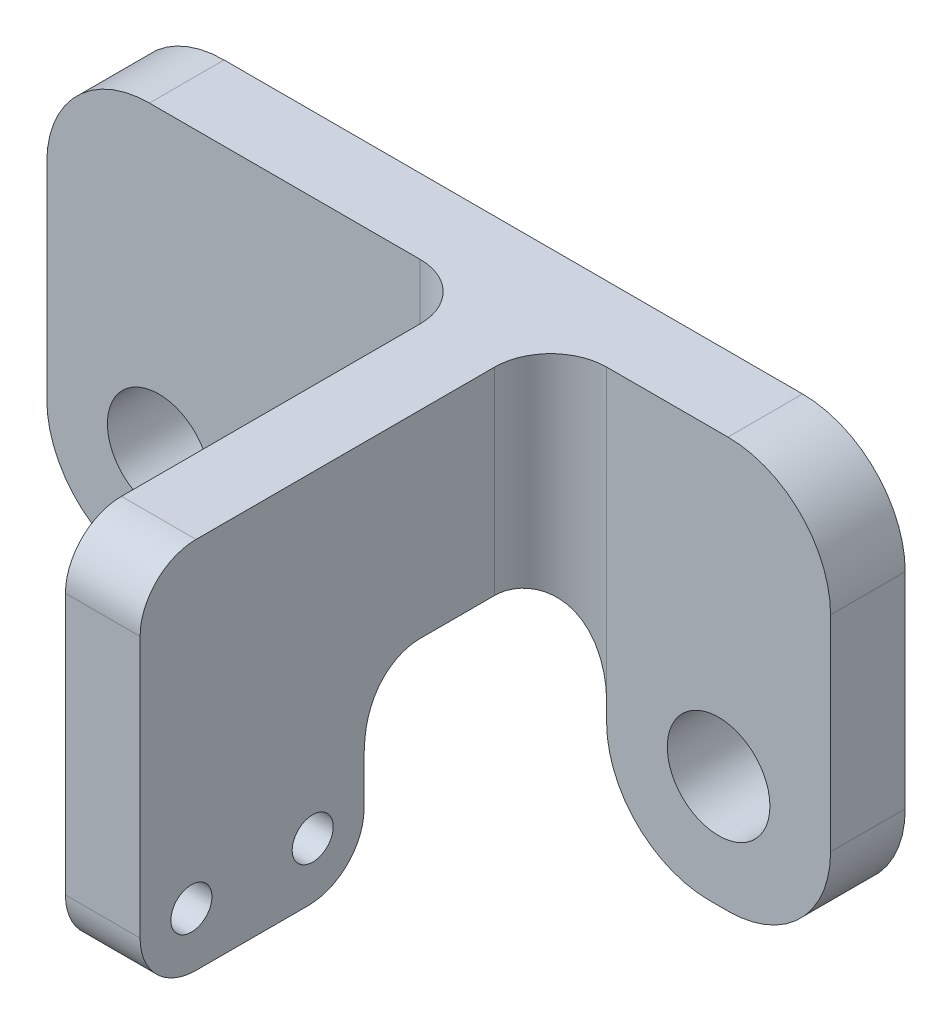
from build123d import *

# Parameters (mm, degrees)
SKETCH1_W           = 12
SKETCH1_H           = 12
SKETCH1_R           = 2.75
BOSS_EXTRUDE1_DEPTH = 4
SKETCH2_W           = 4
SKETCH2_H           = 10
BOSS_EXTRUDE2_DEPTH = 22
SKETCH3_W           = 4
SKETCH3_H           = 12
BOSS_EXTRUDE3_DEPTH = 10
SKETCH4_R           = 1.1
CUT_EXTRUDE1_DEPTH  = 18
FILLET1_R           = 5.5
FILLET2_R           = 3


with BuildPart() as part:
    # Sketch1 → Boss-Extrude1 (new body)
    # profile 1 of 4: a face of its own
    with BuildSketch(Plane.XY):
        Polygon((9, 6), (9, 0), (9, -6), (21, -6), (21, 6), align=None)
        with BuildLine():
            ThreePointArc((17.75, 0), (15, -2.75), (12.25, 0))
            ThreePointArc((12.25, 0), (15, 2.75), (17.75, 0))
        make_face(mode=Mode.SUBTRACT)
    # profile 2 of 4: a face of its own
    with BuildSketch(Plane.XY):
        Polygon((0, 6), (9, 6), (21, 6), (21, 16), (0, 16), align=None)
    # profile 3 of 4: a face of its own
    with BuildSketch(Plane.XY):
        Polygon((-9, 6), (0, 6), (0, 16), (-21, 16), (-21, 6), align=None)
    # profile 4 of 4: a face of its own
    with BuildSketch(Plane.XY):
        with Locations((-15, 0)):
            Rectangle(SKETCH1_W, SKETCH1_H)
        with Locations((-15, 0)):
            Circle(SKETCH1_R, mode=Mode.SUBTRACT)
    extrude(amount=BOSS_EXTRUDE1_DEPTH)

    # Sketch2 → Boss-Extrude2 (add)
    with BuildSketch(Plane.XY.offset(4)):
        with Locations((4, 11)):
            Rectangle(SKETCH2_W, SKETCH2_H)
    extrude(amount=BOSS_EXTRUDE2_DEPTH)

    # Sketch3 → Boss-Extrude3 (add)
    with BuildSketch(Plane.XZ.offset(-6)):
        with Locations((4, 20)):
            Rectangle(SKETCH3_W, SKETCH3_H)
    extrude(amount=BOSS_EXTRUDE3_DEPTH)

    # Sketch4 → Cut-Extrude1 (cut)
    with BuildSketch(Plane.ZY.offset(-2)):
        with Locations((23.25, -1)):
            Circle(SKETCH4_R)
        with Locations((16.75, -1)):
            Circle(SKETCH4_R)
    extrude(amount=-CUT_EXTRUDE1_DEPTH, mode=Mode.SUBTRACT)

    # Fillet1
    fillet1_edges = [part.edges().sort_by_distance(p)[0] for p in [
        (-21, 16, 2),
        (21, 16, 2),
        (21, -6, 2),
        (9, -6, 2),
        (9, 6, 2),
        (-9, 6, 2),
        (-9, -6, 2),
        (-21, -6, 2),
    ]]
    fillet(fillet1_edges, radius=FILLET1_R)

    # Fillet2
    fillet2_edges = [part.edges().sort_by_distance(p)[0] for p in [
        (2.75, 6, 14),
        (4.785615189, 5.847634392, 14),
        (6, 10.699489743, 4),
        (2, 11, 4),
        (4, 16, 26),
        (4, -4, 26),
        (4, -4, 14),
    ]]
    fillet(fillet2_edges, radius=FILLET2_R - 0.0001)  # a hair under: the kernel refuses the full size


solid = part.part
